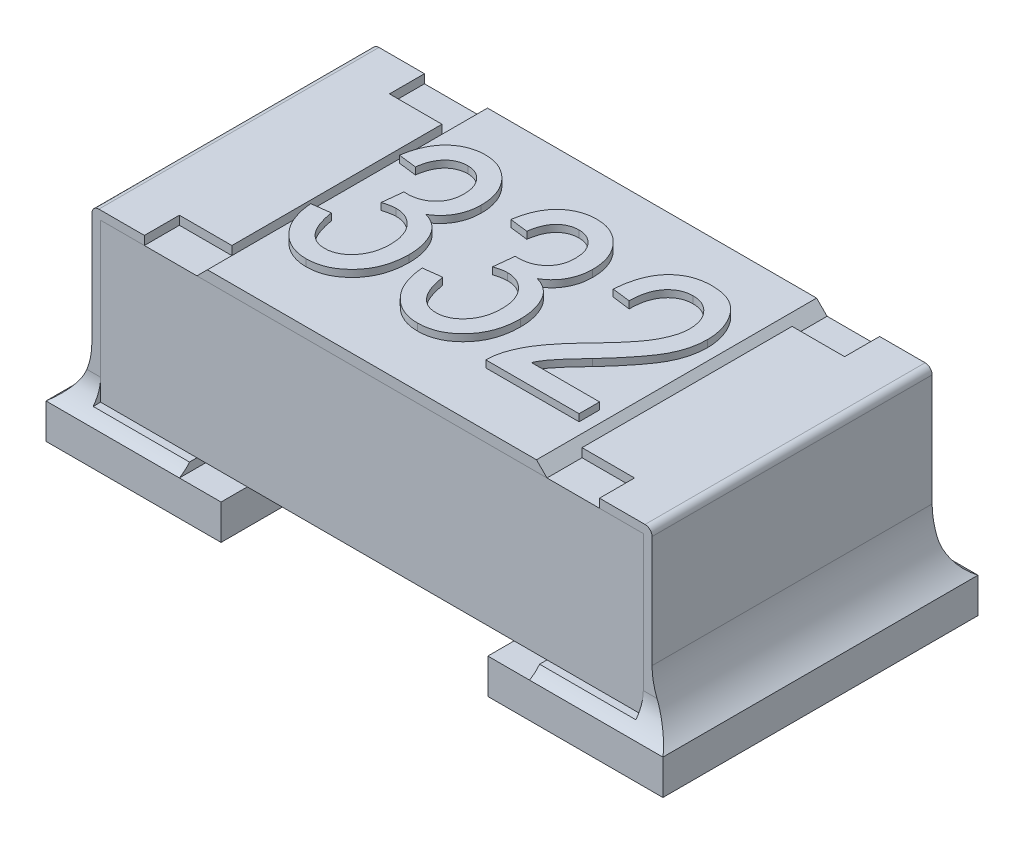
from build123d import *

# Parameters (mm, degrees)
SKETCH1_W             = 0.8
SKETCH1_H             = 0.45
BOSS_EXTRUDE1_DEPTH   = 0.775
BOSS_EXTRUDE2_DEPTH   = 0.4
BOSS_EXTRUDE2_2_DEPTH = 0.4
SKETCH3_W             = 0.15
SKETCH3_H             = 0.1
CUT_EXTRUDE1_DEPTH    = 0.025
BOSS_EXTRUDE3_DEPTH   = 0.4
SKETCH7_W             = 0.5
SKETCH7_H             = 0.9
BOSS_EXTRUDE5_DEPTH   = 0.1
FILLET3_R             = 0.2
FILLET4_R             = 0.2
FILLET5_R             = 0.1
FILLET6_R             = 0.1
BOSS_EXTRU_1_DEPTH    = 0.02


with BuildPart() as part:
    # Sketch1 → Boss-Extrude1 (new, symmetric)
    with BuildSketch(Plane(origin=(0, 0, 0), x_dir=(0, 0, -1), z_dir=(1, 0, 0))):
        with Locations((0, 0.35)):
            Rectangle(SKETCH1_W, SKETCH1_H)
    extrude(amount=BOSS_EXTRUDE1_DEPTH, both=True)


with BuildPart() as body_2:
    # Sketch2 → Boss-Extrude2 (new, symmetric)
    with BuildSketch(Plane.XY):
        with BuildLine():
            Line((-0.5, 0.6), (-0.78, 0.6))
            ThreePointArc((-0.78, 0.6), (-0.794142136, 0.594142136), (-0.8, 0.58))
            Line((-0.8, 0.58), (-0.8, 0.1))
            Line((-0.8, 0.1), (-0.5, 0.1))
            Line((-0.5, 0.1), (-0.5, 0.125))
            Line((-0.5, 0.125), (-0.775, 0.125))
            Line((-0.775, 0.125), (-0.775, 0.575))
            Line((-0.775, 0.575), (-0.5, 0.575))
            Line((-0.5, 0.575), (-0.5, 0.6))
        make_face()
    extrude(amount=BOSS_EXTRUDE2_DEPTH, both=True)


with BuildPart() as body_3:
    # Sketch2 → Boss-Extrude2 2 (new, symmetric)
    with BuildSketch(Plane.XY):
        with BuildLine():
            Line((0.5, 0.575), (0.5, 0.6))
            Line((0.5, 0.6), (0.78, 0.6))
            ThreePointArc((0.78, 0.6), (0.794142136, 0.594142136), (0.8, 0.58))
            Line((0.8, 0.58), (0.8, 0.1))
            Line((0.8, 0.1), (0.5, 0.1))
            Line((0.5, 0.1), (0.5, 0.125))
            Line((0.5, 0.125), (0.775, 0.125))
            Line((0.775, 0.125), (0.775, 0.575))
            Line((0.775, 0.575), (0.5, 0.575))
        make_face()
    extrude(amount=BOSS_EXTRUDE2_2_DEPTH, both=True)


with BuildPart() as cut_extrude1_tool:
    # Sketch3 → Cut-Extrude1 (new body)
    with BuildSketch(Plane(origin=(0, 0.6, 0), x_dir=(1, 0, 0), z_dir=(0, 1, 0))):
        with Locations((-0.575, 0.35)):
            Rectangle(SKETCH3_W, SKETCH3_H)
        with Locations((-0.575, -0.35)):
            Rectangle(SKETCH3_W, SKETCH3_H)
        with Locations((0.575, -0.35)):
            Rectangle(SKETCH3_W, SKETCH3_H)
        with Locations((0.575, 0.35)):
            Rectangle(SKETCH3_W, SKETCH3_H)
    extrude(amount=-CUT_EXTRUDE1_DEPTH)


with BuildPart() as body_2_1:
    add(body_2.part)

    # Cut-Extrude1: cut by cut_extrude1_tool
    add(cut_extrude1_tool.part, mode=Mode.SUBTRACT)



with BuildPart() as body_3_1:
    add(body_3.part)

    # Cut-Extrude1: cut by cut_extrude1_tool
    add(cut_extrude1_tool.part, mode=Mode.SUBTRACT)


with BuildPart() as body_4:
    # Sketch4 → Boss-Extrude3 (new, symmetric)
    with BuildSketch(Plane.XY):
        Polygon((-0.5, 0.575), (0.5, 0.575), (0.47, 0.605), (-0.47, 0.605), align=None)
    extrude(amount=BOSS_EXTRUDE3_DEPTH, both=True)

    # Esquisse2 → Boss.-Extru.1 (add)
    with BuildSketch(Plane(origin=(0, 0.605, 0), x_dir=(1, 0, 0), z_dir=(0, 1, 0))):
        with BuildLine():
            Line((-0.465730847, -0.108858251), (-0.413782795, -0.102364745))
            add(Edge.make_bspline(
                [(-0.413782795, -0.102364745), (-0.413112807, -0.106295854), (-0.411807247, -0.113956147), (-0.409238482, -0.124979634), (-0.406434917, -0.135294754), (-0.403185523, -0.144804398), (-0.399643589, -0.153601456), (-0.395715823, -0.161629834), (-0.391324435, -0.16888819), (-0.386577518, -0.175380729), (-0.38146041, -0.181138198), (-0.375996387, -0.186122883), (-0.370134278, -0.190331218), (-0.363929963, -0.193833451), (-0.357285261, -0.196431554), (-0.350330728, -0.198414424), (-0.34296418, -0.199517263), (-0.337927194, -0.199682771), (-0.335353412, -0.199767342)],
                knots=[0, 0, 0, 0, 1.392235382, 2.712957193, 3.95076201, 5.123471921, 6.220028287, 7.260520794, 8.240826993, 9.178593426, 10.065213643, 10.926376853, 11.755607984, 12.580369742, 13.407158359, 14.241002189, 15.101193065, 16, 16, 16, 16], degree=3))
            add(Edge.make_bspline(
                [(-0.335353412, -0.199767342), (-0.332538353, -0.19971378), (-0.327005308, -0.199608502), (-0.318897007, -0.198040126), (-0.311019345, -0.195898939), (-0.303508158, -0.192563959), (-0.296231184, -0.188466115), (-0.289179307, -0.183522145), (-0.282629652, -0.177410194), (-0.27625154, -0.170691575), (-0.270368923, -0.163232894), (-0.265296718, -0.155086373), (-0.261024926, -0.146371416), (-0.257440303, -0.137192254), (-0.254875092, -0.127399682), (-0.252761962, -0.117188858), (-0.251701981, -0.106343944), (-0.251532173, -0.098950673), (-0.251445133, -0.095161011)],
                knots=[0, 0, 0, 0, 0.904038564, 1.776903143, 2.648138989, 3.525264603, 4.411852617, 5.332561374, 6.2875971, 7.288147468, 8.311042921, 9.337403868, 10.368883854, 11.429611823, 12.501164111, 13.621320171, 14.780729868, 16, 16, 16, 16], degree=3))
            add(Edge.make_bspline(
                [(-0.251445133, -0.095161011), (-0.25153714, -0.091607761), (-0.251716276, -0.084689696), (-0.252701551, -0.074570464), (-0.254506809, -0.064983483), (-0.257204132, -0.05595494), (-0.260398267, -0.047345761), (-0.264475323, -0.03933172), (-0.269286493, -0.031866947), (-0.274729563, -0.025004423), (-0.280738993, -0.018819667), (-0.287076675, -0.013314715), (-0.293845368, -0.008739927), (-0.300874508, -0.004887872), (-0.308355784, -0.002118976), (-0.316071181, 8.4992e-05), (-0.324187909, 0.00130226), (-0.329701668, 0.001454003), (-0.332512503, 0.001531359)],
                knots=[0, 0, 0, 0, 1.208507307, 2.352925112, 3.453685551, 4.520081629, 5.553915499, 6.572344605, 7.570902253, 8.569592363, 9.545641393, 10.499968035, 11.418701314, 12.319183888, 13.218416966, 14.125267075, 15.044288268, 16, 16, 16, 16], degree=3))
            add(Edge.make_bspline(
                [(-0.332512503, 0.001531359), (-0.335054222, 0.001451368), (-0.340472466, 0.001280848), (-0.349004264, -0.00019382), (-0.358446302, -0.00226645), (-0.36492643, -0.004300299), (-0.36832825, -0.005367991)],
                knots=[0, 0, 0, 0, 0.832645691, 1.774971563, 2.831945141, 4, 4, 4, 4], degree=3))
            Line((-0.36832825, -0.005367991), (-0.361834743, 0.053479411))
            Line((-0.361834743, 0.053479411), (-0.354022243, 0.052769184))
            add(Edge.make_bspline(
                [(-0.354022243, 0.052769184), (-0.351007427, 0.052803375), (-0.3451245, 0.052870094), (-0.336520608, 0.054103025), (-0.328313169, 0.05573649), (-0.320585221, 0.058215582), (-0.313242826, 0.06126306), (-0.30640038, 0.06512583), (-0.29993305, 0.069629935), (-0.293956478, 0.074775592), (-0.288591253, 0.080592975), (-0.283798464, 0.086838036), (-0.279836815, 0.093608382), (-0.27654485, 0.100771608), (-0.274020674, 0.108431244), (-0.272178554, 0.116547048), (-0.271199422, 0.125154849), (-0.27101847, 0.131027254), (-0.270925652, 0.134039476)],
                knots=[0, 0, 0, 0, 1.104467345, 2.155189185, 3.181695374, 4.170183668, 5.126157628, 6.092295424, 7.04536858, 8.012620263, 8.977961638, 9.942904556, 10.893715412, 11.848320646, 12.828840281, 13.845861792, 14.895045293, 16, 16, 16, 16], degree=3))
            add(Edge.make_bspline(
                [(-0.270925652, 0.134039476), (-0.271158483, 0.139435179), (-0.271605941, 0.149804754), (-0.275040698, 0.164574052), (-0.281025918, 0.177647183), (-0.289265332, 0.188824396), (-0.299180409, 0.19783145), (-0.310256724, 0.204581268), (-0.322540697, 0.208580551), (-0.331097189, 0.209072848), (-0.335454873, 0.209323567)],
                knots=[0, 0, 0, 0, 1.168747258, 2.246123166, 3.262822778, 4.26410748, 5.234436762, 6.148309006, 7.056963545, 8, 8, 8, 8], degree=3))
            add(Edge.make_bspline(
                [(-0.335454873, 0.209323567), (-0.339982901, 0.209113033), (-0.348791484, 0.208703473), (-0.361387188, 0.204796436), (-0.372975385, 0.198811303), (-0.381422708, 0.191612698), (-0.387408859, 0.184797154), (-0.391632537, 0.179053945), (-0.395385645, 0.172667561), (-0.39856643, 0.165580977), (-0.401627761, 0.157989828), (-0.403792773, 0.149635141), (-0.405955263, 0.14077154), (-0.4068352, 0.134590959), (-0.407289289, 0.131401489)],
                knots=[0, 0, 0, 0, 1.389180941, 2.702438466, 4.019316734, 5.377896697, 6.085434137, 6.807430375, 7.567469407, 8.358691296, 9.195188439, 10.081130764, 11.009773198, 12, 12, 12, 12], degree=3))
            Line((-0.407289289, 0.131401489), (-0.459237341, 0.137894996))
            add(Edge.make_bspline(
                [(-0.459237341, 0.137894996), (-0.458386725, 0.142845406), (-0.456727429, 0.152502178), (-0.453260772, 0.166397742), (-0.44913499, 0.179379068), (-0.444139657, 0.191374675), (-0.438467682, 0.202488701), (-0.432050369, 0.212674243), (-0.424971305, 0.221998173), (-0.416984552, 0.230202962), (-0.408495978, 0.237510554), (-0.399500655, 0.243821526), (-0.39015896, 0.249253588), (-0.380316923, 0.25362975), (-0.370066957, 0.257099842), (-0.359357741, 0.259528187), (-0.348244302, 0.260963741), (-0.340701236, 0.261168011), (-0.336875328, 0.261271619)],
                knots=[0, 0, 0, 0, 1.259750421, 2.457396855, 3.589696629, 4.673763457, 5.713494597, 6.716289503, 7.690389722, 8.644478697, 9.583164327, 10.496506905, 11.397350125, 12.289843847, 13.194037124, 14.107891875, 15.040306322, 16, 16, 16, 16], degree=3))
            add(Edge.make_bspline(
                [(-0.336875328, 0.261271619), (-0.332844064, 0.261152706), (-0.324913169, 0.260918763), (-0.313256414, 0.259123737), (-0.302045795, 0.256325888), (-0.291311157, 0.252246796), (-0.281147915, 0.246873647), (-0.271305727, 0.240572938), (-0.261950545, 0.233023939), (-0.25322899, 0.224349983), (-0.245223381, 0.214858231), (-0.238201607, 0.204659864), (-0.232170532, 0.193927052), (-0.227381442, 0.18250432), (-0.22363811, 0.170506984), (-0.22090271, 0.157915535), (-0.219227721, 0.144704426), (-0.219062239, 0.135701715), (-0.2189776, 0.131097106)],
                knots=[0, 0, 0, 0, 0.987546189, 1.94284647, 2.883618689, 3.814886987, 4.749064414, 5.696240478, 6.674807358, 7.688712876, 8.706405422, 9.713376545, 10.718845743, 11.717906576, 12.742863162, 13.794678478, 14.872046121, 16, 16, 16, 16], degree=3))
            add(Edge.make_bspline(
                [(-0.2189776, 0.131097106), (-0.219133893, 0.12553723), (-0.219439131, 0.114678872), (-0.222381301, 0.09892791), (-0.227050518, 0.084150815), (-0.233562923, 0.070445878), (-0.241678138, 0.057883508), (-0.251425525, 0.046771364), (-0.262549879, 0.036921642), (-0.271008348, 0.031747145), (-0.275288477, 0.029128762)],
                knots=[0, 0, 0, 0, 1.090109576, 2.128968013, 3.132278696, 4.123864162, 5.09769889, 6.057339906, 7.016980922, 8, 8, 8, 8], degree=3))
            add(Edge.make_bspline(
                [(-0.275288477, 0.029128762), (-0.271356899, 0.027919056), (-0.263675094, 0.025555446), (-0.253077464, 0.020232713), (-0.243414234, 0.014051368), (-0.234779961, 0.006637104), (-0.227100626, -0.002012587), (-0.220243477, -0.011957767), (-0.214351943, -0.023293485), (-0.209029241, -0.035737208), (-0.204858001, -0.049280075), (-0.201653268, -0.063651321), (-0.199835984, -0.078846612), (-0.199611759, -0.089237754), (-0.199497081, -0.094552245)],
                knots=[0, 0, 0, 0, 0.945190562, 1.846782401, 2.71900073, 3.580139159, 4.456653473, 5.37426406, 6.352713278, 7.392141409, 8.485180558, 9.608884637, 10.777077804, 12, 12, 12, 12], degree=3))
            add(Edge.make_bspline(
                [(-0.199497081, -0.094552245), (-0.199596583, -0.100206655), (-0.199790841, -0.111245814), (-0.201822335, -0.12742587), (-0.204896868, -0.142815205), (-0.209282638, -0.157468828), (-0.214950046, -0.171273371), (-0.221948905, -0.18430778), (-0.230131625, -0.196573403), (-0.239552704, -0.207898211), (-0.249854098, -0.218037877), (-0.260648779, -0.227099023), (-0.27201825, -0.234700597), (-0.283865675, -0.240980511), (-0.296244045, -0.245749208), (-0.309087119, -0.249234387), (-0.322469202, -0.251292842), (-0.331558508, -0.251573269), (-0.3361651, -0.251715394)],
                knots=[0, 0, 0, 0, 1.16797173, 2.280242353, 3.364490462, 4.408173669, 5.436152277, 6.443028727, 7.460738993, 8.478233232, 9.481512989, 10.444418881, 11.386528098, 12.302557467, 13.209825675, 14.12198051, 15.04819242, 16, 16, 16, 16], degree=3))
            add(Edge.make_bspline(
                [(-0.3361651, -0.251715394), (-0.340433302, -0.251602688), (-0.348840747, -0.25138068), (-0.361184358, -0.249495111), (-0.373028706, -0.246468911), (-0.384329246, -0.242152829), (-0.395217976, -0.236755504), (-0.405526134, -0.230035031), (-0.415382031, -0.222118498), (-0.424643085, -0.213060002), (-0.433105877, -0.202919877), (-0.440792513, -0.191987861), (-0.447544092, -0.180206271), (-0.453039881, -0.167459779), (-0.457743007, -0.15400335), (-0.461504378, -0.139729734), (-0.464262752, -0.124598771), (-0.465234684, -0.11417798), (-0.465730847, -0.108858251)],
                knots=[0, 0, 0, 0, 0.959274814, 1.889566238, 2.800731978, 3.703256649, 4.604498869, 5.528396462, 6.464265966, 7.442996794, 8.436156864, 9.429840861, 10.444772988, 11.483305447, 12.546329121, 13.647537524, 14.799087218, 16, 16, 16, 16], degree=3))
        make_face()
        with BuildLine():
            Line((-0.147549029, -0.108858251), (-0.095600977, -0.102364745))
            add(Edge.make_bspline(
                [(-0.095600977, -0.102364745), (-0.094930989, -0.106295854), (-0.093625428, -0.113956147), (-0.091056663, -0.124979634), (-0.088253099, -0.135294754), (-0.085003705, -0.144804398), (-0.081461771, -0.153601456), (-0.077534005, -0.161629834), (-0.073142617, -0.16888819), (-0.0683957, -0.175380729), (-0.063278592, -0.181138198), (-0.057814569, -0.186122883), (-0.05195246, -0.190331218), (-0.045748145, -0.193833451), (-0.039103443, -0.196431554), (-0.03214891, -0.198414424), (-0.024782362, -0.199517263), (-0.019745376, -0.199682771), (-0.017171594, -0.199767342)],
                knots=[0, 0, 0, 0, 1.392235382, 2.712957193, 3.95076201, 5.123471921, 6.220028287, 7.260520794, 8.240826993, 9.178593426, 10.065213643, 10.926376853, 11.755607984, 12.580369742, 13.407158359, 14.241002189, 15.101193065, 16, 16, 16, 16], degree=3))
            add(Edge.make_bspline(
                [(-0.017171594, -0.199767342), (-0.014356535, -0.19971378), (-0.008823489, -0.199608502), (-0.000715189, -0.198040126), (0.007162473, -0.195898939), (0.01467366, -0.192563959), (0.021950635, -0.188466115), (0.029002511, -0.183522145), (0.035552166, -0.177410194), (0.041930278, -0.170691575), (0.047812895, -0.163232894), (0.0528851, -0.155086373), (0.057156892, -0.146371416), (0.060741515, -0.137192254), (0.063306727, -0.127399682), (0.065419856, -0.117188858), (0.066479837, -0.106343944), (0.066649645, -0.098950673), (0.066736685, -0.095161011)],
                knots=[0, 0, 0, 0, 0.904038564, 1.776903143, 2.648138989, 3.525264603, 4.411852617, 5.332561374, 6.2875971, 7.288147468, 8.311042921, 9.337403868, 10.368883854, 11.429611823, 12.501164111, 13.621320171, 14.780729868, 16, 16, 16, 16], degree=3))
            add(Edge.make_bspline(
                [(0.066736685, -0.095161011), (0.066644678, -0.091607761), (0.066465542, -0.084689696), (0.065480268, -0.074570464), (0.063675009, -0.064983483), (0.060977686, -0.05595494), (0.057783551, -0.047345761), (0.053706495, -0.03933172), (0.048895325, -0.031866947), (0.043452255, -0.025004423), (0.037442825, -0.018819667), (0.031105143, -0.013314715), (0.02433645, -0.008739927), (0.01730731, -0.004887872), (0.009826034, -0.002118976), (0.002110637, 8.4992e-05), (-0.006006091, 0.00130226), (-0.01151985, 0.001454003), (-0.014330685, 0.001531359)],
                knots=[0, 0, 0, 0, 1.208507307, 2.352925112, 3.453685551, 4.520081629, 5.553915499, 6.572344605, 7.570902253, 8.569592363, 9.545641393, 10.499968035, 11.418701314, 12.319183888, 13.218416966, 14.125267075, 15.044288268, 16, 16, 16, 16], degree=3))
            add(Edge.make_bspline(
                [(-0.014330685, 0.001531359), (-0.016872403, 0.001451368), (-0.022290648, 0.001280848), (-0.030822446, -0.00019382), (-0.040264484, -0.00226645), (-0.046744612, -0.004300299), (-0.050146431, -0.005367991)],
                knots=[0, 0, 0, 0, 0.832645691, 1.774971563, 2.831945141, 4, 4, 4, 4], degree=3))
            Line((-0.050146431, -0.005367991), (-0.043652925, 0.053479411))
            Line((-0.043652925, 0.053479411), (-0.035840425, 0.052769184))
            add(Edge.make_bspline(
                [(-0.035840425, 0.052769184), (-0.032825608, 0.052803375), (-0.026942682, 0.052870094), (-0.01833879, 0.054103025), (-0.010131351, 0.05573649), (-0.002403402, 0.058215582), (0.004938992, 0.06126306), (0.011781439, 0.06512583), (0.018248768, 0.069629935), (0.02422534, 0.074775592), (0.029590565, 0.080592975), (0.034383354, 0.086838036), (0.038345004, 0.093608382), (0.041636968, 0.100771608), (0.044161145, 0.108431244), (0.046003264, 0.116547048), (0.046982396, 0.125154849), (0.047163348, 0.131027254), (0.047256166, 0.134039476)],
                knots=[0, 0, 0, 0, 1.104467345, 2.155189185, 3.181695374, 4.170183668, 5.126157628, 6.092295424, 7.04536858, 8.012620263, 8.977961638, 9.942904556, 10.893715412, 11.848320646, 12.828840281, 13.845861792, 14.895045293, 16, 16, 16, 16], degree=3))
            add(Edge.make_bspline(
                [(0.047256166, 0.134039476), (0.047023335, 0.139435179), (0.046575877, 0.149804754), (0.04314112, 0.164574052), (0.0371559, 0.177647183), (0.028916486, 0.188824396), (0.019001409, 0.19783145), (0.007925094, 0.204581268), (-0.004358879, 0.208580551), (-0.012915371, 0.209072848), (-0.017273055, 0.209323567)],
                knots=[0, 0, 0, 0, 1.168747258, 2.246123166, 3.262822778, 4.26410748, 5.234436762, 6.148309006, 7.056963545, 8, 8, 8, 8], degree=3))
            add(Edge.make_bspline(
                [(-0.017273055, 0.209323567), (-0.021801082, 0.209113033), (-0.030609666, 0.208703473), (-0.043205369, 0.204796436), (-0.054793567, 0.198811303), (-0.06324089, 0.191612698), (-0.069227041, 0.184797154), (-0.073450719, 0.179053945), (-0.077203827, 0.172667561), (-0.080384611, 0.165580977), (-0.083445943, 0.157989828), (-0.085610955, 0.149635141), (-0.087773444, 0.14077154), (-0.088653382, 0.134590959), (-0.08910747, 0.131401489)],
                knots=[0, 0, 0, 0, 1.389180941, 2.702438466, 4.019316734, 5.377896697, 6.085434137, 6.807430375, 7.567469407, 8.358691296, 9.195188439, 10.081130764, 11.009773198, 12, 12, 12, 12], degree=3))
            Line((-0.08910747, 0.131401489), (-0.141055522, 0.137894996))
            add(Edge.make_bspline(
                [(-0.141055522, 0.137894996), (-0.140204907, 0.142845406), (-0.138545611, 0.152502178), (-0.135078953, 0.166397742), (-0.130953171, 0.179379068), (-0.125957839, 0.191374675), (-0.120285864, 0.202488701), (-0.113868551, 0.212674243), (-0.106789486, 0.221998173), (-0.098802734, 0.230202962), (-0.09031416, 0.237510554), (-0.081318836, 0.243821526), (-0.071977142, 0.249253588), (-0.062135105, 0.25362975), (-0.051885139, 0.257099842), (-0.041175923, 0.259528187), (-0.030062483, 0.260963741), (-0.022519418, 0.261168011), (-0.018693509, 0.261271619)],
                knots=[0, 0, 0, 0, 1.259750421, 2.457396855, 3.589696629, 4.673763457, 5.713494597, 6.716289503, 7.690389722, 8.644478697, 9.583164327, 10.496506905, 11.397350125, 12.289843847, 13.194037124, 14.107891875, 15.040306322, 16, 16, 16, 16], degree=3))
            add(Edge.make_bspline(
                [(-0.018693509, 0.261271619), (-0.014662246, 0.261152706), (-0.006731351, 0.260918763), (0.004925404, 0.259123737), (0.016136023, 0.256325888), (0.026870662, 0.252246796), (0.037033903, 0.246873647), (0.046876091, 0.240572938), (0.056231273, 0.233023939), (0.064952828, 0.224349983), (0.072958437, 0.214858231), (0.079980212, 0.204659864), (0.086011286, 0.193927052), (0.090800376, 0.18250432), (0.094543708, 0.170506984), (0.097279108, 0.157915535), (0.098954098, 0.144704426), (0.099119579, 0.135701715), (0.099204218, 0.131097106)],
                knots=[0, 0, 0, 0, 0.987546189, 1.94284647, 2.883618689, 3.814886987, 4.749064414, 5.696240478, 6.674807358, 7.688712876, 8.706405422, 9.713376545, 10.718845743, 11.717906576, 12.742863162, 13.794678478, 14.872046121, 16, 16, 16, 16], degree=3))
            add(Edge.make_bspline(
                [(0.099204218, 0.131097106), (0.099047925, 0.12553723), (0.098742687, 0.114678872), (0.095800517, 0.09892791), (0.0911313, 0.084150815), (0.084618895, 0.070445878), (0.076503681, 0.057883508), (0.066756294, 0.046771364), (0.05563194, 0.036921642), (0.047173471, 0.031747145), (0.042893341, 0.029128762)],
                knots=[0, 0, 0, 0, 1.090109576, 2.128968013, 3.132278696, 4.123864162, 5.09769889, 6.057339906, 7.016980922, 8, 8, 8, 8], degree=3))
            add(Edge.make_bspline(
                [(0.042893341, 0.029128762), (0.046824919, 0.027919056), (0.054506724, 0.025555446), (0.065104354, 0.020232713), (0.074767585, 0.014051368), (0.083401857, 0.006637104), (0.091081193, -0.002012587), (0.097938341, -0.011957767), (0.103829875, -0.023293485), (0.109152577, -0.035737208), (0.113323817, -0.049280075), (0.11652855, -0.063651321), (0.118345835, -0.078846612), (0.118570059, -0.089237754), (0.118684737, -0.094552245)],
                knots=[0, 0, 0, 0, 0.945190562, 1.846782401, 2.71900073, 3.580139159, 4.456653473, 5.37426406, 6.352713278, 7.392141409, 8.485180558, 9.608884637, 10.777077804, 12, 12, 12, 12], degree=3))
            add(Edge.make_bspline(
                [(0.118684737, -0.094552245), (0.118585235, -0.100206655), (0.118390977, -0.111245814), (0.116359484, -0.12742587), (0.11328495, -0.142815205), (0.10889918, -0.157468828), (0.103231773, -0.171273371), (0.096232913, -0.18430778), (0.088050193, -0.196573403), (0.078629114, -0.207898211), (0.06832772, -0.218037877), (0.057533039, -0.227099023), (0.046163569, -0.234700597), (0.034316143, -0.240980511), (0.021937773, -0.245749208), (0.009094699, -0.249234387), (-0.004287384, -0.251292842), (-0.01337669, -0.251573269), (-0.017983282, -0.251715394)],
                knots=[0, 0, 0, 0, 1.16797173, 2.280242353, 3.364490462, 4.408173669, 5.436152277, 6.443028727, 7.460738993, 8.478233232, 9.481512989, 10.444418881, 11.386528098, 12.302557467, 13.209825675, 14.12198051, 15.04819242, 16, 16, 16, 16], degree=3))
            add(Edge.make_bspline(
                [(-0.017983282, -0.251715394), (-0.022251484, -0.251602688), (-0.030658928, -0.25138068), (-0.04300254, -0.249495111), (-0.054846888, -0.246468911), (-0.066147428, -0.242152829), (-0.077036158, -0.236755504), (-0.087344316, -0.230035031), (-0.097200213, -0.222118498), (-0.106461267, -0.213060002), (-0.114924058, -0.202919877), (-0.122610694, -0.191987861), (-0.129362274, -0.180206271), (-0.134858063, -0.167459779), (-0.139561189, -0.15400335), (-0.14332256, -0.139729734), (-0.146080933, -0.124598771), (-0.147052866, -0.11417798), (-0.147549029, -0.108858251)],
                knots=[0, 0, 0, 0, 0.959274814, 1.889566238, 2.800731978, 3.703256649, 4.604498869, 5.528396462, 6.464265966, 7.442996794, 8.436156864, 9.429840861, 10.444772988, 11.483305447, 12.546329121, 13.647537524, 14.799087218, 16, 16, 16, 16], degree=3))
        make_face()
        with BuildLine():
            Line((0.436866556, -0.186780329), (0.436866556, -0.245221888))
            Line((0.436866556, -0.245221888), (0.170632789, -0.245221888))
            add(Edge.make_bspline(
                [(0.170632789, -0.245221888), (0.170620463, -0.242176838), (0.170595488, -0.236007517), (0.171425805, -0.226601844), (0.173131761, -0.216968453), (0.175310093, -0.206978835), (0.17839873, -0.196764374), (0.182179794, -0.186275439), (0.186641118, -0.175538143), (0.191864922, -0.164488895), (0.197969199, -0.153021711), (0.205335292, -0.141184566), (0.213800759, -0.128765128), (0.223376797, -0.115839112), (0.234250689, -0.102529104), (0.246099687, -0.088637518), (0.259092893, -0.074193289), (0.268344083, -0.064593521), (0.273108439, -0.059649647)],
                knots=[0, 0, 0, 0, 0.672188691, 1.361865275, 2.08134618, 2.831455259, 3.618325166, 4.435686407, 5.292818481, 6.184803937, 7.133719261, 8.159707436, 9.261705982, 10.452168352, 11.710682541, 13.056179633, 14.483934645, 16, 16, 16, 16], degree=3))
            add(Edge.make_bspline(
                [(0.273108439, -0.059649647), (0.278645154, -0.053922862), (0.28930567, -0.042896383), (0.304309328, -0.026615111), (0.317941658, -0.011481871), (0.329930295, 0.002776991), (0.340488081, 0.015967273), (0.349721239, 0.028070116), (0.357188517, 0.039360185), (0.365251054, 0.052644574), (0.372937537, 0.068459429), (0.379732824, 0.086894144), (0.384123449, 0.104715028), (0.384658645, 0.116463957), (0.384918504, 0.122168535)],
                knots=[0, 0, 0, 0, 1.312560889, 2.527233899, 3.64818266, 4.668586789, 5.596397896, 6.432357998, 7.175835261, 7.825761013, 8.992224112, 10.065918602, 11.060925749, 12, 12, 12, 12], degree=3))
            add(Edge.make_bspline(
                [(0.384918504, 0.122168535), (0.38488227, 0.125317915), (0.384811501, 0.131468985), (0.383608892, 0.140451965), (0.381893813, 0.14899617), (0.3796294, 0.157163351), (0.376418723, 0.164819361), (0.372571791, 0.172017316), (0.368065657, 0.178789817), (0.362923472, 0.185037408), (0.357252813, 0.190673516), (0.351276734, 0.195736851), (0.344839772, 0.199834879), (0.338206488, 0.203402296), (0.33115273, 0.205987741), (0.323827032, 0.207958519), (0.316161618, 0.209069733), (0.310956748, 0.209238117), (0.308315419, 0.209323567)],
                knots=[0, 0, 0, 0, 1.164486654, 2.274364258, 3.346924328, 4.388668322, 5.404300818, 6.412115579, 7.404820287, 8.409522099, 9.400647826, 10.360464378, 11.301161788, 12.219192522, 13.141987859, 14.073903283, 15.022558797, 16, 16, 16, 16], degree=3))
            add(Edge.make_bspline(
                [(0.308315419, 0.209323567), (0.305467549, 0.209263822), (0.299908376, 0.209147197), (0.291805518, 0.207697867), (0.284041492, 0.205758951), (0.276655696, 0.202751859), (0.269702154, 0.198899959), (0.263080695, 0.194263463), (0.256920928, 0.188754733), (0.251098767, 0.182490648), (0.245994902, 0.175347606), (0.241308805, 0.167618053), (0.237618701, 0.158974566), (0.234481048, 0.149683668), (0.232023772, 0.139637057), (0.230381279, 0.128872622), (0.229176758, 0.117392989), (0.229109112, 0.109489326), (0.229074348, 0.105427463)],
                knots=[0, 0, 0, 0, 0.928788257, 1.813037313, 2.680996359, 3.53827917, 4.408273621, 5.272359245, 6.172129225, 7.102295458, 8.058839945, 9.034325244, 10.048074492, 11.120300332, 12.234644845, 13.420320921, 14.674247329, 16, 16, 16, 16], degree=3))
            Line((0.229074348, 0.105427463), (0.177126296, 0.11192097))
            add(Edge.make_bspline(
                [(0.177126296, 0.11192097), (0.177661646, 0.117949128), (0.178700249, 0.129644029), (0.181425255, 0.146574214), (0.185206691, 0.162282392), (0.189695492, 0.176925272), (0.195342921, 0.190321129), (0.201656925, 0.202713751), (0.209140532, 0.213833745), (0.217485989, 0.223818585), (0.226623406, 0.232677174), (0.236501282, 0.24032371), (0.247106206, 0.246769595), (0.258317066, 0.252189545), (0.270365598, 0.256236922), (0.283035651, 0.259174418), (0.296430274, 0.260914731), (0.305570867, 0.261150899), (0.310243179, 0.261271619)],
                knots=[0, 0, 0, 0, 1.296155121, 2.514599762, 3.669097984, 4.755193195, 5.79120272, 6.77953026, 7.729955905, 8.65570694, 9.562583864, 10.450894749, 11.325630111, 12.216772649, 13.112585423, 14.04224033, 14.999270054, 16, 16, 16, 16], degree=3))
            add(Edge.make_bspline(
                [(0.310243179, 0.261271619), (0.315287924, 0.261123536), (0.325110881, 0.260835194), (0.339410791, 0.258935248), (0.352748071, 0.255583871), (0.365182294, 0.250920378), (0.376564128, 0.244781019), (0.387078711, 0.237416689), (0.396550564, 0.228603521), (0.404979649, 0.21857538), (0.412428841, 0.207748797), (0.418928747, 0.196427916), (0.424566895, 0.18480032), (0.428973266, 0.172736626), (0.432653055, 0.16039874), (0.434964779, 0.147599635), (0.436592216, 0.134486989), (0.436774592, 0.125623379), (0.436866556, 0.121153924)],
                knots=[0, 0, 0, 0, 1.141256367, 2.222215694, 3.255808886, 4.246221905, 5.218350639, 6.173592628, 7.142736081, 8.136099926, 9.131465336, 10.11177911, 11.087094076, 12.050634184, 13.014356534, 13.995714735, 14.989343724, 16, 16, 16, 16], degree=3))
            add(Edge.make_bspline(
                [(0.436866556, 0.121153924), (0.436779909, 0.117127141), (0.436607744, 0.109126037), (0.4354878, 0.097187936), (0.43351089, 0.085410333), (0.43094396, 0.073679984), (0.427301469, 0.062178516), (0.423177974, 0.050723257), (0.418176495, 0.039443439), (0.412272125, 0.028118881), (0.405358874, 0.016348836), (0.397074513, 0.003918486), (0.387572676, -0.009504436), (0.376467413, -0.023680764), (0.364296829, -0.039018169), (0.350523248, -0.055130192), (0.335415402, -0.072158915), (0.324771484, -0.083713449), (0.319273211, -0.089682115)],
                knots=[0, 0, 0, 0, 0.78053567, 1.550902233, 2.321464013, 3.094364546, 3.87611052, 4.657966429, 5.453363508, 6.265521698, 7.132350641, 8.097801917, 9.160103787, 10.319208993, 11.587678713, 12.955014444, 14.427067756, 16, 16, 16, 16], degree=3))
            add(Edge.make_bspline(
                [(0.319273211, -0.089682115), (0.31578272, -0.093395828), (0.30911211, -0.100493032), (0.299665728, -0.110762774), (0.291188926, -0.120105032), (0.28349715, -0.128388282), (0.276970664, -0.135891091), (0.271312279, -0.142415262), (0.266688943, -0.148041211), (0.259760015, -0.156885556), (0.251020841, -0.169347157), (0.244983139, -0.181095194), (0.242061361, -0.186780329)],
                knots=[0, 0, 0, 0, 1.227496676, 2.345844757, 3.360613726, 4.265798447, 5.068085109, 5.75545707, 6.345771879, 6.821573405, 8.46188917, 10, 10, 10, 10], degree=3))
            Line((0.242061361, -0.186780329), (0.436866556, -0.186780329))
        make_face()
    extrude(amount=BOSS_EXTRU_1_DEPTH)


with BuildPart() as body_2_2:
    add(body_2_1.part)

    add(body_3_1.part)  # Boss-Extrude5 merges body 3
    # Sketch7 → Boss-Extrude5 (add)
    with BuildSketch(Plane(origin=(0, 0, 0), x_dir=(1, 0, 0), z_dir=(0, 1, 0))):
        with Locations((-0.631, 0)):
            Rectangle(SKETCH7_W, SKETCH7_H)
        with Locations((0.631, 0)):
            Rectangle(SKETCH7_W, SKETCH7_H)
    extrude(amount=BOSS_EXTRUDE5_DEPTH)

    # Fillet3
    # the kernel refuses this fillet: 0.2 mm, written as the material it adds along each edge
    with BuildSketch(Plane(origin=(-0.8, 0.1, -0.4), x_dir=(-1.0, 1.981473969784949e-11, 0), z_dir=(0, 0, 1))) as fillet3_piece_1:
        with BuildLine():
            CenterArc((0.2, -0.16074514), FILLET3_R, 126.5126321, 53.487367901)
            Line((0, -0.16074514), (-0.004, -0.16074514))
            Line((-0.004, -0.16074514), (-0.004, 0))
            Line((-0.004, 0), (0, 0.004))
            ThreePointArc((0, 0.004), (0.0405, 0.004), (0.07862, 0.003214903))
            Line((0.07862, 0.003214903), (0.081, 0))
        make_face()
    extrude(amount=0.8)

    # Fillet4
    # the kernel refuses this fillet: 0.2 mm, written as the material it adds along each edge
    with BuildSketch(Plane(origin=(0.8, 0.1, 0.4), x_dir=(1.0, 1.981542502070424e-11, 0), z_dir=(0, 0, -1))) as fillet4_piece_1:
        with BuildLine():
            CenterArc((0.2, -0.16074514), FILLET4_R, 126.5126321, 53.487367901)
            Line((0, -0.16074514), (-0.004, -0.16074514))
            Line((-0.004, -0.16074514), (-0.004, 0))
            Line((-0.004, 0), (0, 0.004))
            ThreePointArc((0, 0.004), (0.0405, 0.004), (0.07862, 0.003214903))
            Line((0.07862, 0.003214903), (0.081, 0))
        make_face()
    extrude(amount=0.8)

    # Fillet5
    # the kernel refuses this fillet: 0.1 mm, written as the material it adds along each edge
    with BuildSketch(Plane(origin=(0.5, 0.1, 0.4), x_dir=(0, -1.6392998070069752e-11, 1.0), z_dir=(1.0, 4.321346430286522e-12, 0))) as fillet5_piece_1_section:
        with BuildLine():
            CenterArc((0.1, -0.08660254), FILLET5_R, 119.999999999, 60)
            Line((0, -0.08660254), (-0.002, -0.08660254))
            Line((-0.002, -0.08660254), (-0.002, 0))
            Line((-0.002, 0), (0, 0.002))
            ThreePointArc((0, 0.002), (0.025, 0.002), (0.049, 0.001732051))
            Line((0.049, 0.001732051), (0.05, 0))
        make_face()
    fillet5_piece_1 = extrude(amount=0.381, mode=Mode.PRIVATE)
    fillet5_piece_1 = split(fillet5_piece_1, bisect_by=Plane(origin=(0.5, 0.125, 0.4), z_dir=(0, -1, 0)), keep=Keep.TOP, mode=Mode.PRIVATE)
    fillet5_piece_1 = split(fillet5_piece_1, bisect_by=Plane(origin=(0.775, 0.1, 0.4), z_dir=(-1, 0, 0)), keep=Keep.TOP, mode=Mode.PRIVATE)
    add(fillet5_piece_1)
    with BuildSketch(Plane(origin=(0.5, 0.1, 0.4), x_dir=(0, -1.6392998070069752e-11, 1.0), z_dir=(1.0, 4.321346430286522e-12, 0))) as fillet5_piece_2_section:
        with BuildLine():
            CenterArc((0.1, -0.08660254), FILLET5_R, 119.999999999, 60)
            Line((0, -0.08660254), (-0.002, -0.08660254))
            Line((-0.002, -0.08660254), (-0.002, 0))
            Line((-0.002, 0), (0, 0.002))
            ThreePointArc((0, 0.002), (0.025, 0.002), (0.049, 0.001732051))
            Line((0.049, 0.001732051), (0.05, 0))
        make_face()
    fillet5_piece_2 = extrude(amount=0.381, mode=Mode.PRIVATE)
    fillet5_piece_2 = fillet5_piece_2 - Plane(origin=(1, 0.26074514, 0.4), x_dir=(1.0, 2e-11, 0), z_dir=(0, 0, 1)) * Cylinder(0.2, 2, mode=Mode.PRIVATE)
    fillet5_piece_2 = split(fillet5_piece_2, bisect_by=Plane(origin=(0.5, 0.125, 0.4), z_dir=(0, -1, 0)), keep=Keep.TOP, mode=Mode.PRIVATE)
    fillet5_piece_2 = split(fillet5_piece_2, bisect_by=Plane(origin=(0.775, 0.1, 0.4), z_dir=(1, 0, 0)), keep=Keep.TOP, mode=Mode.PRIVATE)
    add(fillet5_piece_2)
    with BuildSketch(Plane(origin=(0.5, 0.1, 0.4), x_dir=(0, -1.6392998070069752e-11, 1.0), z_dir=(1.0, 4.321346430286522e-12, 0))) as fillet5_piece_3_section:
        with BuildLine():
            CenterArc((0.1, -0.08660254), FILLET5_R, 119.999999999, 60)
            Line((0, -0.08660254), (-0.002, -0.08660254))
            Line((-0.002, -0.08660254), (-0.002, 0))
            Line((-0.002, 0), (0, 0.002))
            ThreePointArc((0, 0.002), (0.025, 0.002), (0.049, 0.001732051))
            Line((0.049, 0.001732051), (0.05, 0))
        make_face()
    fillet5_piece_3 = extrude(amount=0.381, mode=Mode.PRIVATE)
    fillet5_piece_3 = fillet5_piece_3 - Plane(origin=(1, 0.26074514, 0.4), x_dir=(1.0, 2e-11, 0), z_dir=(0, 0, 1)) * Cylinder(0.2, 2, mode=Mode.PRIVATE)
    fillet5_piece_3 = split(fillet5_piece_3, bisect_by=Plane(origin=(0.5, 0.125, 0.4), z_dir=(0, 1, 0)), keep=Keep.TOP, mode=Mode.PRIVATE)
    fillet5_piece_3 = split(fillet5_piece_3, bisect_by=Plane(origin=(0.775, 0.1, 0.4), z_dir=(1, 0, 0)), keep=Keep.TOP, mode=Mode.PRIVATE)
    add(fillet5_piece_3)
    # the kernel refuses this fillet: 0.1 mm, written as the material it adds along each edge
    with BuildSketch(Plane(origin=(0.881, 0.1, -0.4), x_dir=(0, -1.639244295855736e-11, -1.0), z_dir=(-1.0, -4.321346430286522e-12, 0))) as fillet5_2_piece_1_section:
        with BuildLine():
            CenterArc((0.1, -0.08660254), FILLET5_R, 119.999999999, 60)
            Line((0, -0.08660254), (-0.002, -0.08660254))
            Line((-0.002, -0.08660254), (-0.002, 0))
            Line((-0.002, 0), (0, 0.002))
            ThreePointArc((0, 0.002), (0.025, 0.002), (0.049, 0.001732051))
            Line((0.049, 0.001732051), (0.05, 0))
        make_face()
    fillet5_2_piece_1 = extrude(amount=0.381, mode=Mode.PRIVATE)
    fillet5_2_piece_1 = fillet5_2_piece_1 - Plane(origin=(1, 0.26074514, -0.4), x_dir=(1.0, 2e-11, 0), z_dir=(0, 0, 1)) * Cylinder(0.2, 2, mode=Mode.PRIVATE)
    fillet5_2_piece_1 = split(fillet5_2_piece_1, bisect_by=Plane(origin=(0.881, 0.125, -0.4), z_dir=(0, -1, 0)), keep=Keep.TOP, mode=Mode.PRIVATE)
    fillet5_2_piece_1 = split(fillet5_2_piece_1, bisect_by=Plane(origin=(0.775, 0.1, -0.4), z_dir=(1, 0, 0)), keep=Keep.TOP, mode=Mode.PRIVATE)
    add(fillet5_2_piece_1)
    with BuildSketch(Plane(origin=(0.881, 0.1, -0.4), x_dir=(0, -1.639244295855736e-11, -1.0), z_dir=(-1.0, -4.321346430286522e-12, 0))) as fillet5_2_piece_2_section:
        with BuildLine():
            CenterArc((0.1, -0.08660254), FILLET5_R, 119.999999999, 60)
            Line((0, -0.08660254), (-0.002, -0.08660254))
            Line((-0.002, -0.08660254), (-0.002, 0))
            Line((-0.002, 0), (0, 0.002))
            ThreePointArc((0, 0.002), (0.025, 0.002), (0.049, 0.001732051))
            Line((0.049, 0.001732051), (0.05, 0))
        make_face()
    fillet5_2_piece_2 = extrude(amount=0.381, mode=Mode.PRIVATE)
    fillet5_2_piece_2 = fillet5_2_piece_2 - Plane(origin=(1, 0.26074514, -0.4), x_dir=(1.0, 2e-11, 0), z_dir=(0, 0, 1)) * Cylinder(0.2, 2, mode=Mode.PRIVATE)
    fillet5_2_piece_2 = split(fillet5_2_piece_2, bisect_by=Plane(origin=(0.881, 0.125, -0.4), z_dir=(0, 1, 0)), keep=Keep.TOP, mode=Mode.PRIVATE)
    fillet5_2_piece_2 = split(fillet5_2_piece_2, bisect_by=Plane(origin=(0.775, 0.1, -0.4), z_dir=(1, 0, 0)), keep=Keep.TOP, mode=Mode.PRIVATE)
    add(fillet5_2_piece_2)
    with BuildSketch(Plane(origin=(0.881, 0.1, -0.4), x_dir=(0, -1.639244295855736e-11, -1.0), z_dir=(-1.0, -4.321346430286522e-12, 0))) as fillet5_2_piece_3_section:
        with BuildLine():
            CenterArc((0.1, -0.08660254), FILLET5_R, 119.999999999, 60)
            Line((0, -0.08660254), (-0.002, -0.08660254))
            Line((-0.002, -0.08660254), (-0.002, 0))
            Line((-0.002, 0), (0, 0.002))
            ThreePointArc((0, 0.002), (0.025, 0.002), (0.049, 0.001732051))
            Line((0.049, 0.001732051), (0.05, 0))
        make_face()
    fillet5_2_piece_3 = extrude(amount=0.381, mode=Mode.PRIVATE)
    fillet5_2_piece_3 = split(fillet5_2_piece_3, bisect_by=Plane(origin=(0.881, 0.125, -0.4), z_dir=(0, -1, 0)), keep=Keep.TOP, mode=Mode.PRIVATE)
    fillet5_2_piece_3 = split(fillet5_2_piece_3, bisect_by=Plane(origin=(0.775, 0.1, -0.4), z_dir=(-1, 0, 0)), keep=Keep.TOP, mode=Mode.PRIVATE)
    add(fillet5_2_piece_3)

    # Fillet6
    # the kernel refuses this fillet: 0.1 mm, written as the material it adds along each edge
    with BuildSketch(Plane(origin=(-0.5, 0.1, -0.4), x_dir=(0, -1.6393275625825854e-11, -1.0), z_dir=(-1.0, 4.321237156366773e-12, 0))) as fillet6_piece_1_section:
        with BuildLine():
            CenterArc((0.1, -0.08660254), FILLET6_R, 119.999999999, 60)
            Line((0, -0.08660254), (-0.002, -0.08660254))
            Line((-0.002, -0.08660254), (-0.002, 0))
            Line((-0.002, 0), (0, 0.002))
            ThreePointArc((0, 0.002), (0.025, 0.002), (0.049, 0.001732051))
            Line((0.049, 0.001732051), (0.05, 0))
        make_face()
    fillet6_piece_1 = extrude(amount=0.381, mode=Mode.PRIVATE)
    fillet6_piece_1 = split(fillet6_piece_1, bisect_by=Plane(origin=(-0.5, 0.125, -0.4), z_dir=(0, -1, 0)), keep=Keep.TOP, mode=Mode.PRIVATE)
    fillet6_piece_1 = split(fillet6_piece_1, bisect_by=Plane(origin=(-0.775, 0.1, -0.4), z_dir=(1, 0, 0)), keep=Keep.TOP, mode=Mode.PRIVATE)
    add(fillet6_piece_1)
    with BuildSketch(Plane(origin=(-0.5, 0.1, -0.4), x_dir=(0, -1.6393275625825854e-11, -1.0), z_dir=(-1.0, 4.321237156366773e-12, 0))) as fillet6_piece_2_section:
        with BuildLine():
            CenterArc((0.1, -0.08660254), FILLET6_R, 119.999999999, 60)
            Line((0, -0.08660254), (-0.002, -0.08660254))
            Line((-0.002, -0.08660254), (-0.002, 0))
            Line((-0.002, 0), (0, 0.002))
            ThreePointArc((0, 0.002), (0.025, 0.002), (0.049, 0.001732051))
            Line((0.049, 0.001732051), (0.05, 0))
        make_face()
    fillet6_piece_2 = extrude(amount=0.381, mode=Mode.PRIVATE)
    fillet6_piece_2 = fillet6_piece_2 - Plane(origin=(-1, 0.26074514, -0.4), x_dir=(-1.0, 2e-11, 0), z_dir=(0, 0, -1)) * Cylinder(0.2, 2, mode=Mode.PRIVATE)
    fillet6_piece_2 = split(fillet6_piece_2, bisect_by=Plane(origin=(-0.5, 0.125, -0.4), z_dir=(0, -1, 0)), keep=Keep.TOP, mode=Mode.PRIVATE)
    fillet6_piece_2 = split(fillet6_piece_2, bisect_by=Plane(origin=(-0.775, 0.1, -0.4), z_dir=(-1, 0, 0)), keep=Keep.TOP, mode=Mode.PRIVATE)
    add(fillet6_piece_2)
    with BuildSketch(Plane(origin=(-0.5, 0.1, -0.4), x_dir=(0, -1.6393275625825854e-11, -1.0), z_dir=(-1.0, 4.321237156366773e-12, 0))) as fillet6_piece_3_section:
        with BuildLine():
            CenterArc((0.1, -0.08660254), FILLET6_R, 119.999999999, 60)
            Line((0, -0.08660254), (-0.002, -0.08660254))
            Line((-0.002, -0.08660254), (-0.002, 0))
            Line((-0.002, 0), (0, 0.002))
            ThreePointArc((0, 0.002), (0.025, 0.002), (0.049, 0.001732051))
            Line((0.049, 0.001732051), (0.05, 0))
        make_face()
    fillet6_piece_3 = extrude(amount=0.381, mode=Mode.PRIVATE)
    fillet6_piece_3 = fillet6_piece_3 - Plane(origin=(-1, 0.26074514, -0.4), x_dir=(-1.0, 2e-11, 0), z_dir=(0, 0, -1)) * Cylinder(0.2, 2, mode=Mode.PRIVATE)
    fillet6_piece_3 = split(fillet6_piece_3, bisect_by=Plane(origin=(-0.5, 0.125, -0.4), z_dir=(0, 1, 0)), keep=Keep.TOP, mode=Mode.PRIVATE)
    fillet6_piece_3 = split(fillet6_piece_3, bisect_by=Plane(origin=(-0.775, 0.1, -0.4), z_dir=(-1, 0, 0)), keep=Keep.TOP, mode=Mode.PRIVATE)
    add(fillet6_piece_3)
    # the kernel refuses this fillet: 0.1 mm, written as the material it adds along each edge
    with BuildSketch(Plane(origin=(-0.881, 0.1, 0.4), x_dir=(0, -1.6393830737338195e-11, 1.0), z_dir=(1.0, -4.321237156366773e-12, 0))) as fillet6_2_piece_1_section:
        with BuildLine():
            CenterArc((0.1, -0.08660254), FILLET6_R, 119.999999999, 60)
            Line((0, -0.08660254), (-0.002, -0.08660254))
            Line((-0.002, -0.08660254), (-0.002, 0))
            Line((-0.002, 0), (0, 0.002))
            ThreePointArc((0, 0.002), (0.025, 0.002), (0.049, 0.001732051))
            Line((0.049, 0.001732051), (0.05, 0))
        make_face()
    fillet6_2_piece_1 = extrude(amount=0.381, mode=Mode.PRIVATE)
    fillet6_2_piece_1 = fillet6_2_piece_1 - Plane(origin=(-1, 0.26074514, 0.4), x_dir=(-1.0, 2e-11, 0), z_dir=(0, 0, -1)) * Cylinder(0.2, 2, mode=Mode.PRIVATE)
    fillet6_2_piece_1 = split(fillet6_2_piece_1, bisect_by=Plane(origin=(-0.881, 0.125, 0.4), z_dir=(0, -1, 0)), keep=Keep.TOP, mode=Mode.PRIVATE)
    fillet6_2_piece_1 = split(fillet6_2_piece_1, bisect_by=Plane(origin=(-0.775, 0.1, 0.4), z_dir=(-1, 0, 0)), keep=Keep.TOP, mode=Mode.PRIVATE)
    add(fillet6_2_piece_1)
    with BuildSketch(Plane(origin=(-0.881, 0.1, 0.4), x_dir=(0, -1.6393830737338195e-11, 1.0), z_dir=(1.0, -4.321237156366773e-12, 0))) as fillet6_2_piece_2_section:
        with BuildLine():
            CenterArc((0.1, -0.08660254), FILLET6_R, 119.999999999, 60)
            Line((0, -0.08660254), (-0.002, -0.08660254))
            Line((-0.002, -0.08660254), (-0.002, 0))
            Line((-0.002, 0), (0, 0.002))
            ThreePointArc((0, 0.002), (0.025, 0.002), (0.049, 0.001732051))
            Line((0.049, 0.001732051), (0.05, 0))
        make_face()
    fillet6_2_piece_2 = extrude(amount=0.381, mode=Mode.PRIVATE)
    fillet6_2_piece_2 = fillet6_2_piece_2 - Plane(origin=(-1, 0.26074514, 0.4), x_dir=(-1.0, 2e-11, 0), z_dir=(0, 0, -1)) * Cylinder(0.2, 2, mode=Mode.PRIVATE)
    fillet6_2_piece_2 = split(fillet6_2_piece_2, bisect_by=Plane(origin=(-0.881, 0.125, 0.4), z_dir=(0, 1, 0)), keep=Keep.TOP, mode=Mode.PRIVATE)
    fillet6_2_piece_2 = split(fillet6_2_piece_2, bisect_by=Plane(origin=(-0.775, 0.1, 0.4), z_dir=(-1, 0, 0)), keep=Keep.TOP, mode=Mode.PRIVATE)
    add(fillet6_2_piece_2)
    with BuildSketch(Plane(origin=(-0.881, 0.1, 0.4), x_dir=(0, -1.6393830737338195e-11, 1.0), z_dir=(1.0, -4.321237156366773e-12, 0))) as fillet6_2_piece_3_section:
        with BuildLine():
            CenterArc((0.1, -0.08660254), FILLET6_R, 119.999999999, 60)
            Line((0, -0.08660254), (-0.002, -0.08660254))
            Line((-0.002, -0.08660254), (-0.002, 0))
            Line((-0.002, 0), (0, 0.002))
            ThreePointArc((0, 0.002), (0.025, 0.002), (0.049, 0.001732051))
            Line((0.049, 0.001732051), (0.05, 0))
        make_face()
    fillet6_2_piece_3 = extrude(amount=0.381, mode=Mode.PRIVATE)
    fillet6_2_piece_3 = split(fillet6_2_piece_3, bisect_by=Plane(origin=(-0.881, 0.125, 0.4), z_dir=(0, -1, 0)), keep=Keep.TOP, mode=Mode.PRIVATE)
    fillet6_2_piece_3 = split(fillet6_2_piece_3, bisect_by=Plane(origin=(-0.775, 0.1, 0.4), z_dir=(1, 0, 0)), keep=Keep.TOP, mode=Mode.PRIVATE)
    add(fillet6_2_piece_3)


solid = Compound([part.part, body_4.part, body_2_2.part])
